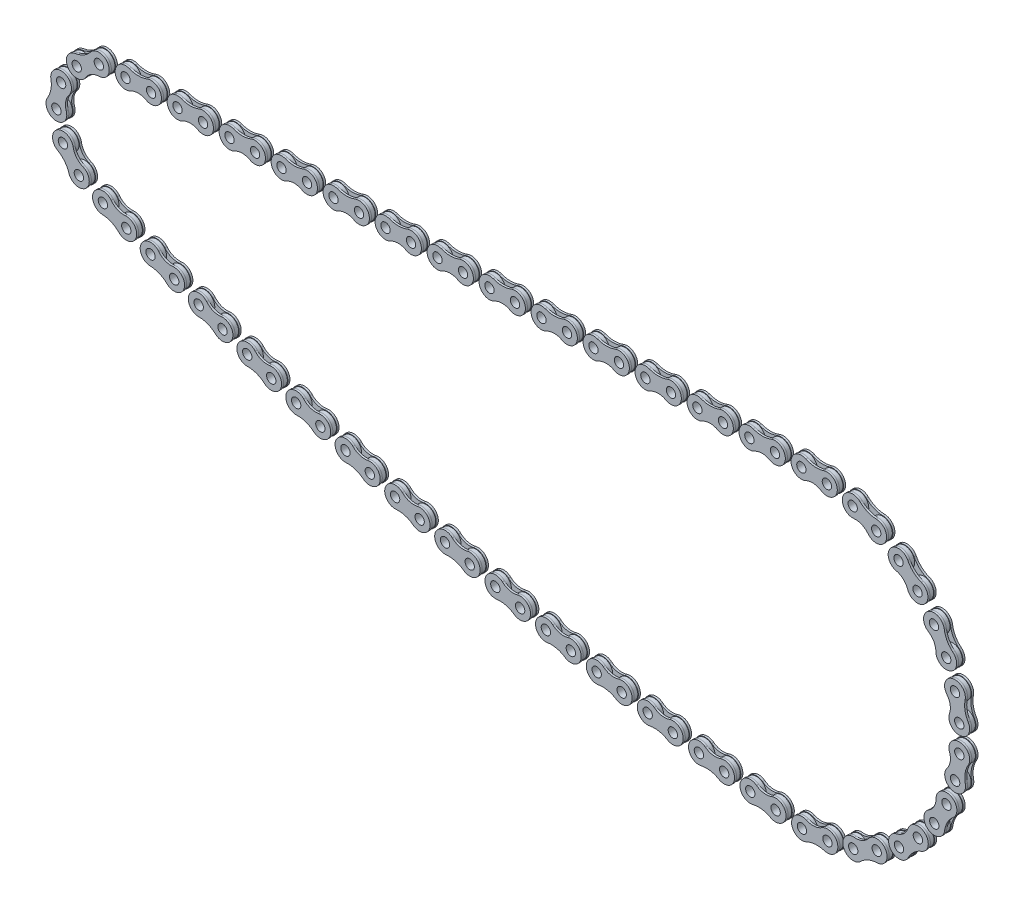
from build123d import *

# Parameters (mm, degrees)
SKETCH1_R             = 4.75
SKETCH1_R_2           = 2.25
BOSS_EXTRUDE1_DEPTH   = 1
BOSS_EXTRUDE1_2_DEPTH = 1
SKETCH2_R             = 2.25
BOSS_EXTRUDE2_DEPTH   = 1
CRVPATTERN1_5_ANGLE   = 3.8901012
CRVPATTERN1_6_ANGLE   = 23.0027709
CRVPATTERN1_7_ANGLE   = 42.1154406
CRVPATTERN1_8_ANGLE   = 61.2281103
CRVPATTERN1_9_ANGLE   = 80.34078
CRVPATTERN1_10_ANGLE  = 99.4534497
CRVPATTERN1_11_ANGLE  = 118.5661194
CRVPATTERN1_12_ANGLE  = 137.6787891
CRVPATTERN1_13_ANGLE  = 156.7914588
CRVPATTERN1_14_ANGLE  = 175.9041285
CRVPATTERN1_15_ANGLE  = 172.3357403
CRVPATTERN1_16_ANGLE  = 171.095109
CRVPATTERN1_17_ANGLE  = 169.8544777
CRVPATTERN1_18_ANGLE  = 168.6138464
CRVPATTERN1_19_ANGLE  = 167.3732151
CRVPATTERN1_20_ANGLE  = 166.1325838
CRVPATTERN1_21_ANGLE  = 164.8919525
CRVPATTERN1_22_ANGLE  = 163.6513212
CRVPATTERN1_23_ANGLE  = 162.4106898
CRVPATTERN1_24_ANGLE  = 161.1700585
CRVPATTERN1_25_ANGLE  = 159.9294272
CRVPATTERN1_26_ANGLE  = 158.6887959
CRVPATTERN1_27_ANGLE  = 157.4481646
CRVPATTERN1_28_ANGLE  = 156.2075333
CRVPATTERN1_29_ANGLE  = 128.6116148
CRVPATTERN1_30_ANGLE  = 79.3521569
CRVPATTERN1_31_ANGLE  = 30.0926989


with BuildPart() as part:
    # Sketch1 → Boss-Extrude1 (new, symmetric)
    with BuildSketch(Plane.XY):
        with Locations((-6.15, 0)):
            Circle(SKETCH1_R)
        with Locations((-6.15, 0)):
            Circle(SKETCH1_R_2, mode=Mode.SUBTRACT)
    extrude(amount=BOSS_EXTRUDE1_DEPTH, both=True)



with BuildPart() as body_2:
    # Sketch1 → Boss-Extrude1 2 (new, symmetric)
    with BuildSketch(Plane.XY):
        with Locations(Location((6.15, 0, 0), (0, 0, 180))):
            Circle(SKETCH1_R)
        with Locations((6.15, 0)):
            Circle(SKETCH1_R_2, mode=Mode.SUBTRACT)
    extrude(amount=BOSS_EXTRUDE1_2_DEPTH, both=True)


with BuildPart() as part_1:
    add(part.part)

    add(body_2.part)  # Boss-Extrude2 merges body 2
    # Sketch2 → Boss-Extrude2 (add)
    with BuildSketch(Plane.XY.offset(1)):
        with BuildLine():
            ThreePointArc((-4.324033217, 4.654658452), (-11.13941745, -0.325136145), (-3.735397732, -4.378321127))
            ThreePointArc((-3.735397732, -4.378321127), (0, -3.416581844), (3.735397732, -4.378321127))
            ThreePointArc((3.735397732, -4.378321127), (11.13941745, -0.325136145), (4.324033217, 4.654658452))
            ThreePointArc((4.324033217, 4.654658452), (0, 3.836862456), (-4.324033217, 4.654658452))
        make_face()
        with Locations((-6.15, 0)):
            Circle(SKETCH2_R, mode=Mode.SUBTRACT)
        with Locations((6.15, 0)):
            Circle(SKETCH2_R, mode=Mode.SUBTRACT)
    boss_extrude2 = extrude(amount=BOSS_EXTRUDE2_DEPTH)

    # Mirror1: Boss-Extrude2 across plane
    add(boss_extrude2.mirror(Plane.XY))


with BuildPart() as body_2_2:
    # CrvPattern1: read off the stored shape, not the designer's step
    # CrvPattern1: copy of part
    add(part_1.part.moved(Location((25.0184261, 0, 0))))


with BuildPart() as body_3:
    # CrvPattern1 2: copy of part
    add(part_1.part.moved(Location((50.0368522, 0, 0))))


with BuildPart() as body_4:
    # CrvPattern1 3: copy of part
    add(part_1.part.moved(Location((75.0552784, 0, 0))))


with BuildPart() as body_5:
    # CrvPattern1 4: copy of part
    add(part_1.part.moved(Location((100.0737045, 0, 0))))


with BuildPart() as body_6:
    # CrvPattern1 5: copy of part
    add(part_1.part.moved(Location((124.808204, 8.3138296, 0))).rotate(Axis((0, 0, 0), (0, 0, -1)), CRVPATTERN1_5_ANGLE))


with BuildPart() as body_7:
    # CrvPattern1 6: copy of part
    add(part_1.part.moved(Location((139.7461147, 52.8524852, 0))).rotate(Axis((0, 0, 0), (0, 0, -1)), CRVPATTERN1_6_ANGLE))


with BuildPart() as body_8:
    # CrvPattern1 7: copy of part
    add(part_1.part.moved(Location((139.2774444, 99.8270886, 0))).rotate(Axis((0, 0, 0), (0, 0, -1)), CRVPATTERN1_7_ANGLE))


with BuildPart() as body_9:
    # CrvPattern1 8: copy of part
    add(part_1.part.moved(Location((123.4538627, 144.0588338, 0))).rotate(Axis((0, 0, 0), (0, 0, -1)), CRVPATTERN1_8_ANGLE))


with BuildPart() as body_10:
    # CrvPattern1 9: copy of part
    add(part_1.part.moved(Location((94.0198708, 180.6713063, 0))).rotate(Axis((0, 0, 0), (0, 0, -1)), CRVPATTERN1_9_ANGLE))


with BuildPart() as body_11:
    # CrvPattern1 10: copy of part
    add(part_1.part.moved(Location((54.2204763, 205.6280932, 0))).rotate(Axis((0, 0, 0), (0, 0, -1)), CRVPATTERN1_10_ANGLE))


with BuildPart() as body_12:
    # CrvPattern1 11: copy of part
    add(part_1.part.moved(Location((8.4434405, 216.1777853, 0))).rotate(Axis((0, 0, 0), (0, 0, -1)), CRVPATTERN1_11_ANGLE))


with BuildPart() as body_13:
    # CrvPattern1 12: copy of part
    add(part_1.part.moved(Location((-38.2644589, 211.1573114, 0))).rotate(Axis((0, 0, 0), (0, 0, -1)), CRVPATTERN1_12_ANGLE))


with BuildPart() as body_14:
    # CrvPattern1 13: copy of part
    add(part_1.part.moved(Location((-80.7538188, 191.1201632, 0))).rotate(Axis((0, 0, 0), (0, 0, -1)), CRVPATTERN1_13_ANGLE))


with BuildPart() as body_15:
    # CrvPattern1 14: copy of part
    add(part_1.part.moved(Location((-114.3403177, 158.275375, 0))).rotate(Axis((0, 0, 0), (0, 0, -1)), CRVPATTERN1_14_ANGLE))


with BuildPart() as body_16:
    # CrvPattern1 15: copy of part
    add(part_1.part.moved(Location((-119.2993138, 133.2648955, 0))).rotate(Axis((0, 0, 0), (0, 0, 1)), CRVPATTERN1_15_ANGLE))


with BuildPart() as body_17:
    # CrvPattern1 16: copy of part
    add(part_1.part.moved(Location((-97.1413782, 130.9214978, 0))).rotate(Axis((0, 0, 0), (0, 0, 1)), CRVPATTERN1_16_ANGLE))


with BuildPart() as body_18:
    # CrvPattern1 17: copy of part
    add(part_1.part.moved(Location((-74.9378989, 129.0584, 0))).rotate(Axis((0, 0, 0), (0, 0, 1)), CRVPATTERN1_17_ANGLE))


with BuildPart() as body_19:
    # CrvPattern1 18: copy of part
    add(part_1.part.moved(Location((-52.6992859, 127.6764756, 0))).rotate(Axis((0, 0, 0), (0, 0, 1)), CRVPATTERN1_18_ANGLE))


with BuildPart() as body_20:
    # CrvPattern1 19: copy of part
    add(part_1.part.moved(Location((-30.4359655, 126.7763724, 0))).rotate(Axis((0, 0, 0), (0, 0, 1)), CRVPATTERN1_19_ANGLE))


with BuildPart() as body_21:
    # CrvPattern1 20: copy of part
    add(part_1.part.moved(Location((-8.1583754, 126.3585125, 0))).rotate(Axis((0, 0, 0), (0, 0, 1)), CRVPATTERN1_20_ANGLE))


with BuildPart() as body_22:
    # CrvPattern1 21: copy of part
    add(part_1.part.moved(Location((14.1230395, 126.4230918, 0))).rotate(Axis((0, 0, 0), (0, 0, 1)), CRVPATTERN1_21_ANGLE))


with BuildPart() as body_23:
    # CrvPattern1 22: copy of part
    add(part_1.part.moved(Location((36.3978331, 126.9700799, 0))).rotate(Axis((0, 0, 0), (0, 0, 1)), CRVPATTERN1_22_ANGLE))


with BuildPart() as body_24:
    # CrvPattern1 23: copy of part
    add(part_1.part.moved(Location((58.6555619, 127.9992205, 0))).rotate(Axis((0, 0, 0), (0, 0, 1)), CRVPATTERN1_23_ANGLE))


with BuildPart() as body_25:
    # CrvPattern1 24: copy of part
    add(part_1.part.moved(Location((80.8857908, 129.5100311, 0))).rotate(Axis((0, 0, 0), (0, 0, 1)), CRVPATTERN1_24_ANGLE))


with BuildPart() as body_26:
    # CrvPattern1 25: copy of part
    add(part_1.part.moved(Location((103.0780973, 131.5018032, 0))).rotate(Axis((0, 0, 0), (0, 0, 1)), CRVPATTERN1_25_ANGLE))


with BuildPart() as body_27:
    # CrvPattern1 26: copy of part
    add(part_1.part.moved(Location((125.2220768, 133.9736032, 0))).rotate(Axis((0, 0, 0), (0, 0, 1)), CRVPATTERN1_26_ANGLE))


with BuildPart() as body_28:
    # CrvPattern1 27: copy of part
    add(part_1.part.moved(Location((147.3073474, 136.9242721, 0))).rotate(Axis((0, 0, 0), (0, 0, 1)), CRVPATTERN1_27_ANGLE))


with BuildPart() as body_29:
    # CrvPattern1 28: copy of part
    add(part_1.part.moved(Location((169.3235546, 140.3524265, 0))).rotate(Axis((0, 0, 0), (0, 0, 1)), CRVPATTERN1_28_ANGLE))


with BuildPart() as body_30:
    # CrvPattern1 29: copy of part
    add(part_1.part.moved(Location((108.2765383, 211.1753912, 0))).rotate(Axis((0, 0, 0), (0, 0, 1)), CRVPATTERN1_29_ANGLE))


with BuildPart() as body_31:
    # CrvPattern1 30: copy of part
    add(part_1.part.moved(Location((-67.3280351, 229.9487863, 0))).rotate(Axis((0, 0, 0), (0, 0, 1)), CRVPATTERN1_30_ANGLE))


with BuildPart() as body_32:
    # CrvPattern1 31: copy of part
    add(part_1.part.moved(Location((-196.1577609, 109.1501593, 0))).rotate(Axis((0, 0, 0), (0, 0, 1)), CRVPATTERN1_31_ANGLE))


with BuildPart() as body_33:
    # CrvPattern1 32: copy of part
    add(part_1.part.moved(Location((-200.147409, 0, 0))))


with BuildPart() as body_34:
    # CrvPattern1 33: copy of part
    add(part_1.part.moved(Location((-175.1289829, 0, 0))))


with BuildPart() as body_35:
    # CrvPattern1 34: copy of part
    add(part_1.part.moved(Location((-150.1105567, 0, 0))))


with BuildPart() as body_36:
    # CrvPattern1 35: copy of part
    add(part_1.part.moved(Location((-125.0921306, 0, 0))))


with BuildPart() as body_37:
    # CrvPattern1 36: copy of part
    add(part_1.part.moved(Location((-100.0737045, 0, 0))))


with BuildPart() as body_38:
    # CrvPattern1 37: copy of part
    add(part_1.part.moved(Location((-75.0552784, 0, 0))))


with BuildPart() as body_39:
    # CrvPattern1 38: copy of part
    add(part_1.part.moved(Location((-50.0368522, 0, 0))))


with BuildPart() as body_40:
    # CrvPattern1 39: copy of part
    add(part_1.part.moved(Location((-25.0184261, 0, 0))))


solid = Compound([part_1.part, body_2_2.part, body_3.part, body_4.part, body_5.part, body_6.part, body_7.part, body_8.part, body_9.part, body_10.part, body_11.part, body_12.part, body_13.part, body_14.part, body_15.part, body_16.part, body_17.part, body_18.part, body_19.part, body_20.part, body_21.part, body_22.part, body_23.part, body_24.part, body_25.part, body_26.part, body_27.part, body_28.part, body_29.part, body_30.part, body_31.part, body_32.part, body_33.part, body_34.part, body_35.part, body_36.part, body_37.part, body_38.part, body_39.part, body_40.part])
